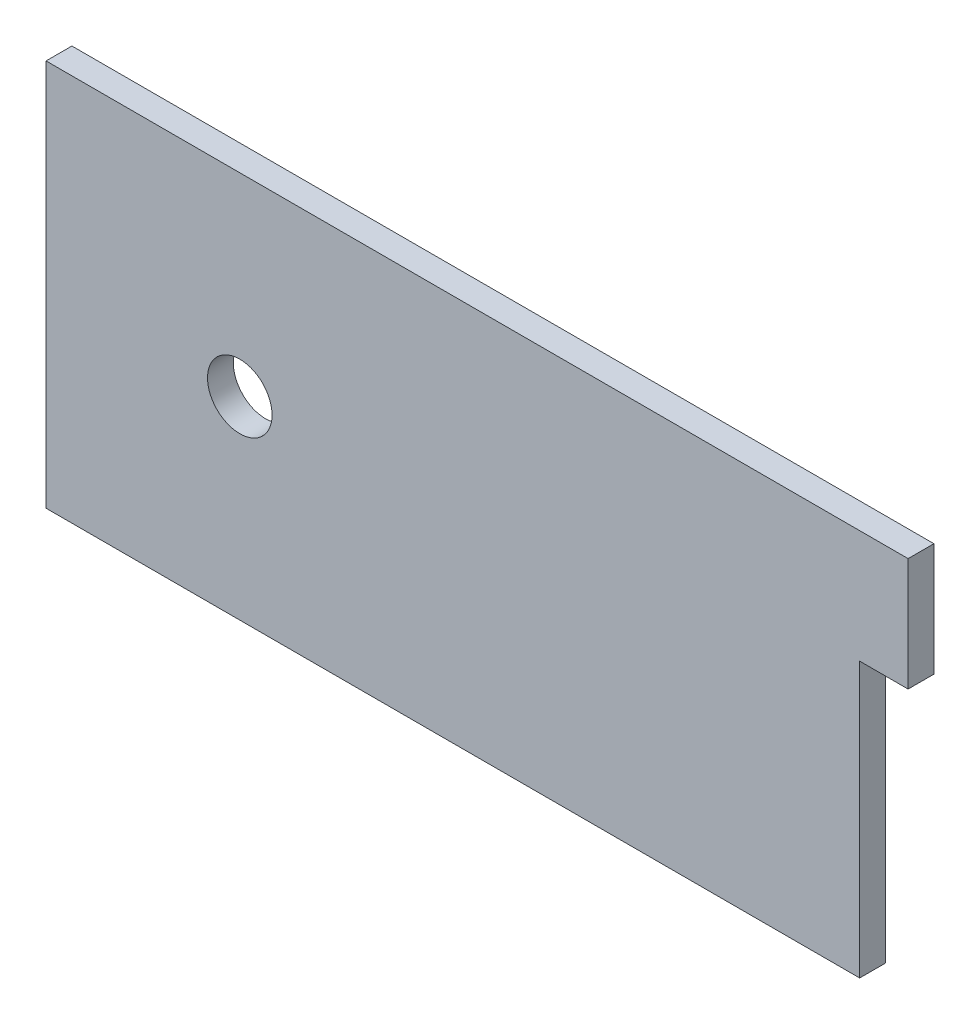
from build123d import *

# Parameters (mm, degrees)
SKETCH1_R           = 5
BOSS_EXTRUDE1_DEPTH = 4


with BuildPart() as part:
    # Sketch1 → Boss-Extrude1 (new body)
    with BuildSketch(Plane.XY):
        Polygon((45, 30), (52.5, 30), (52.5, 12.5), (45, 12.5), (45, -30), (-81, -30), (-81, 30), align=None)
        with Locations((-51, 0)):
            Circle(SKETCH1_R, mode=Mode.SUBTRACT)
    extrude(amount=BOSS_EXTRUDE1_DEPTH)


solid = part.part
